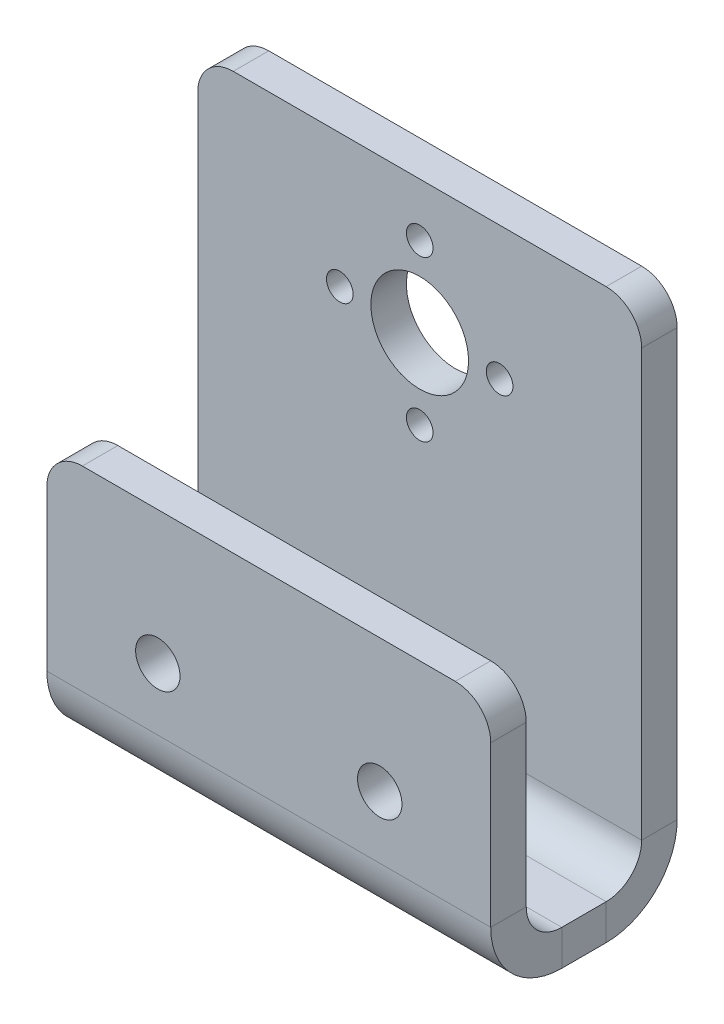
from build123d import *

# Parameters (mm, degrees)
BOSS_EXTRUDE1_DEPTH    = 50
SKETCH2_R              = 5.5
SKETCH2_R_2            = 1.5
CUT_EXTRUDE1_DEPTH     = 50
SKETCH3_R              = 2.5
CUT_EXTRUDE3_DEPTH     = 10
CONVERT_SOLID1_DEPTH   = 50
CONVERT_SOLID1_2_DEPTH = 50
FILLET1_R              = 4


# Read off the part's stored shape, not the designer's step: Convert-Solid1
with BuildPart() as part:
    # Sketch1 → Boss-Extrude1 (new body)
    with BuildSketch(Plane(origin=(0, 0, 0), x_dir=(0, 0, -1), z_dir=(1, 0, 0))):
        Polygon((0, 0), (0, -60), (-21, -60), (-21, -30), (-17, -30), (-17, -56), (-4, -56), (-4, 0), align=None)
    extrude(amount=BOSS_EXTRUDE1_DEPTH)

    # Sketch2 → Cut-Extrude1 (cut)
    with BuildSketch(Plane.XY.offset(4)):
        with Locations((25, -15)):
            Circle(SKETCH2_R)
        with Locations((25, -6)):
            Circle(SKETCH2_R_2)
        with Locations((16, -15)):
            Circle(SKETCH2_R_2)
        with Locations((25, -24)):
            Circle(SKETCH2_R_2)
        with Locations((34, -15)):
            Circle(SKETCH2_R_2)
    extrude(amount=-CUT_EXTRUDE1_DEPTH, mode=Mode.SUBTRACT)

    # Sketch3 → Cut-Extrude3 (cut)
    with BuildSketch(Plane.XY.offset(21)):
        with Locations((12.5, -45)):
            Circle(SKETCH3_R)
        with Locations((37.5, -45)):
            Circle(SKETCH3_R)
    extrude(amount=-CUT_EXTRUDE3_DEPTH, mode=Mode.SUBTRACT)

    # Convert-Solid1 outline → Convert-Solid1 (cut)
    with BuildSketch(Plane.YZ):
        with BuildLine():
            Line((-60, 21), (-60, 13))
            ThreePointArc((-60, 13), (-57.656854249, 18.656854249), (-52, 21))
            Line((-52, 21), (-60, 21))
        make_face()
        with BuildLine():
            ThreePointArc((-52, 0), (-57.656854249, 2.343145751), (-60, 8))
            Line((-60, 8), (-60, 0))
            Line((-60, 0), (-52, 0))
        make_face()
    extrude(amount=CONVERT_SOLID1_DEPTH, mode=Mode.SUBTRACT)

    # Convert-Solid1 2 outline → Convert-Solid1 2 (add)
    with BuildSketch(Plane.YZ):
        with BuildLine():
            ThreePointArc((-52, 4), (-54.828427125, 5.171572875), (-56, 8))
            Line((-56, 8), (-56, 4))
            Line((-56, 4), (-52, 4))
        make_face()
        with BuildLine():
            Line((-56, 17), (-56, 13))
            ThreePointArc((-56, 13), (-54.828427125, 15.828427125), (-52, 17))
            Line((-52, 17), (-56, 17))
        make_face()
    extrude(amount=CONVERT_SOLID1_2_DEPTH)

    # Fillet1
    fillet1_edges = [part.edges().sort_by_distance(p)[0] for p in [
        (50, -30, 19),
        (0, -30, 19),
        (0, 0, 2),
        (50, 0, 2),
    ]]
    fillet(fillet1_edges, radius=FILLET1_R)


solid = part.part
